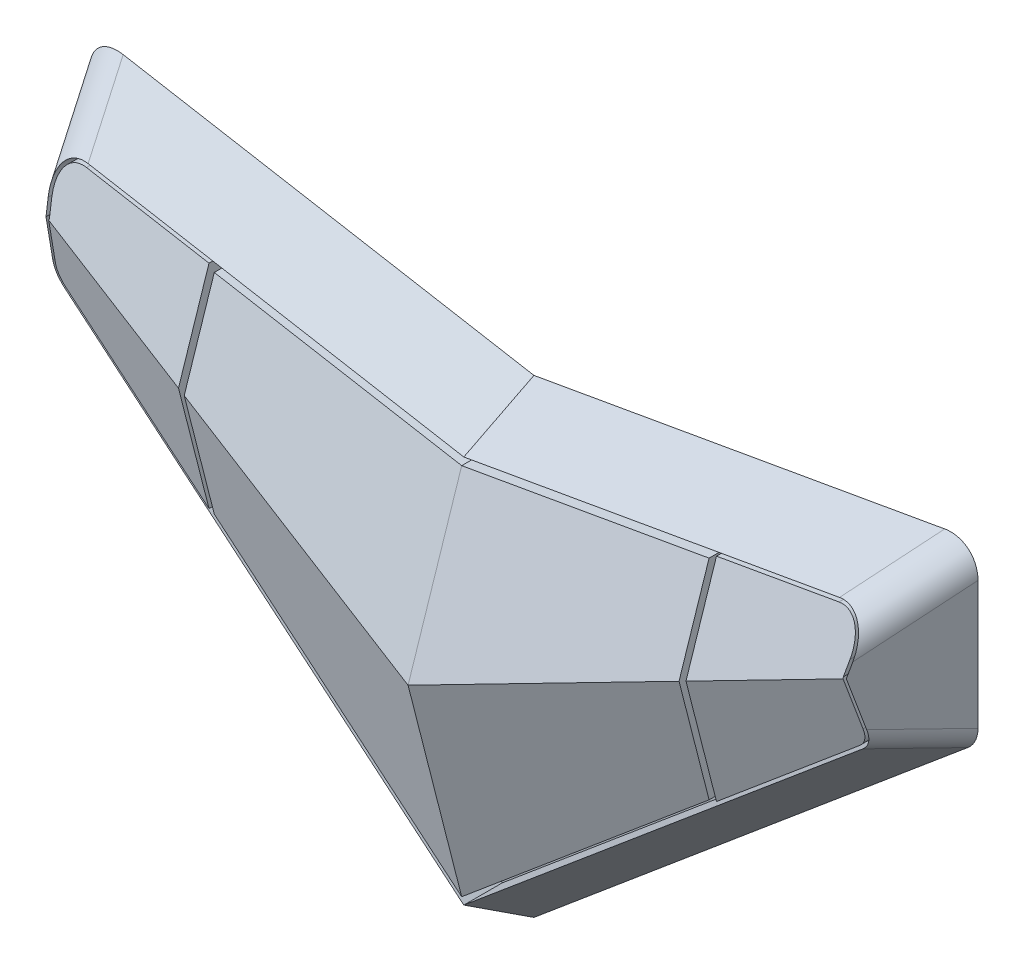
from build123d import *

# Parameters (mm, degrees)
CHAMFER_1_SIZE      = 10
CHAMFER_1_SIZE_2    = 22.360679775
FILLET_3_R          = 5
CUT_EXTRUDE_START   = 5
CUT_EXTRUDE_2_DEPTH = 108.268120159
CUT_EXTRUDE_3_DEPTH = 108.268120141


with BuildPart() as part:
    # 草图1 → 放样1 section 0
    with BuildSketch(Plane.XY):
        with BuildLine():
            Line((0, 74), (70, 86.34288865))
            Line((70, 86.34288865), (70, 58.736974182))
            Line((70, 58.736974182), (0, 0))
            Line((0, 0), (-70, 58.736974182))
            Line((-70, 58.736974182), (-70, 86.34288865))
            Line((-70, 86.34288865), (0, 74))
        make_face()
    # 草图2 → 放样1 section 1
    with BuildSketch(Plane.XY.offset(20)):
        with BuildLine():
            Line((60, 74.425352724), (0, 63.845733881))
            Line((0, 63.845733881), (-60, 74.425352724))
            Line((-60, 74.425352724), (-60, 63.400050764))
            Line((-60, 63.400050764), (0, 13.054072893))
            Line((0, 13.054072893), (60, 63.400050764))
            Line((60, 63.400050764), (60, 74.425352724))
        make_face()
    loft()

    # 倒角1
    # the kernel refuses this chamfer: 22.360679775, 10 mm, written as the material it takes off along each edge
    with BuildSketch(Plane(origin=(57.145762753, 53.769394075, 20), x_dir=(0.07765782588644504, 0.44041941610082364, -0.8944271909999159), z_dir=(-0.9848077530122075, 0.17364817766693405, 0))) as chamfer_1_piece_1_section:
        Polygon((CHAMFER_1_SIZE, 0), (-CHAMFER_1_SIZE_2 * 0.4472135955, CHAMFER_1_SIZE_2 * 0.894427191), (0, 0), align=None)
    chamfer_1_piece_1 = extrude(amount=176.980253225, mode=Mode.PRIVATE)
    chamfer_1_piece_1 = split(chamfer_1_piece_1, bisect_by=Plane(origin=(57.189420764, 53.521797191, 19.245750606), z_dir=(-0.05491237529650921, 0.3114235556911101, 0.9486832980505147)), keep=Keep.TOP, mode=Mode.PRIVATE)
    add(chamfer_1_piece_1, mode=Mode.SUBTRACT)
    with BuildSketch(Plane(origin=(117.145762753, 84.50169253, 20), x_dir=(-0.0776578258864451, 0.4404194161008233, -0.8944271909999161), z_dir=(-0.9848077530122074, -0.1736481776669343, 0))) as chamfer_1_piece_2_section:
        Polygon((CHAMFER_1_SIZE, 0), (-CHAMFER_1_SIZE_2 * 0.4472135955, CHAMFER_1_SIZE_2 * 0.894427191), (0, 0), align=None)
    chamfer_1_piece_2 = extrude(amount=176.980253225, mode=Mode.PRIVATE)
    chamfer_1_piece_2 = split(chamfer_1_piece_2, bisect_by=Plane(origin=(116.05099823, 78.292974393, 1.086507133), z_dir=(0.054912375296509185, 0.31142355569111035, 0.9486832980505147)), keep=Keep.TOP, mode=Mode.PRIVATE)
    add(chamfer_1_piece_2, mode=Mode.SUBTRACT)
    with BuildSketch(Plane(origin=(-44.451512359, -24.245174733, 20), x_dir=(0.28746335807073986, -0.34258548972000163, -0.894427190999916), z_dir=(0.7660444431189795, 0.6427876096865376, 0)), Plane(origin=(-104.451512359, 100.69929839, 20), x_dir=(-0.28746335807074064, -0.3425854897200026, -0.8944271909999154), z_dir=(0.7660444431189795, -0.6427876096865376, 0))) as chamfer_1_piece_3:
        Polygon((CHAMFER_1_SIZE, 0), (-CHAMFER_1_SIZE_2 * 0.4472135955, CHAMFER_1_SIZE_2 * 0.894427191), (0, 0), align=None)
    extrude(amount=194.379093872, mode=Mode.SUBTRACT)

    # 圆角3
    fillet_3_edges = [part.edges().sort_by_distance(p)[0] for p in [
        (-67.236067978, 60.025816851, 5.527864045),
        (-67.236067978, 83.048962732, 5.527864045),
        (67.236067977, 60.025816851, 5.527864045),
        (67.236067977, 83.048962732, 5.527864045),
    ]]
    fillet(fillet_3_edges, radius=FILLET_3_R)

    # 草图7 → 切除-拉伸2 (cut, through all)
    with BuildSketch(Plane.XY.offset(CUT_EXTRUDE_START)):
        Polygon((-40, 75.43993897), (-40, 40.780099266), (0, 7.216114019), (40, 40.780099266), (40, 75.43993897), (0, 68.386859742), align=None)
        Polygon((-39, 74.248185378), (0, 67.37143313), (39, 74.248185378), (39, 41.246406924), (0, 8.521521308), (-39, 41.246406924), align=None, mode=Mode.SUBTRACT)
    extrude(amount=CUT_EXTRUDE_2_DEPTH, mode=Mode.SUBTRACT)

    # 草图9 → 切除-拉伸3 (cut, through all)
    with BuildSketch(Plane.XY.offset(CUT_EXTRUDE_START)):
        with BuildLine():
            Line((-40, 75.43993897), (0, 68.386859742))
            Line((0, 68.386859742), (40, 75.43993897))
            Line((40, 75.43993897), (59.223421741, 78.829546885))
            add(Edge.make_bspline(
                [(63.422393112, 73.174317919), (64.472135955, 79.755036815), (59.223421741, 78.829546885)],
                knots=[2.124820971, 2.124820971, 2.124820971, 3.634497794, 3.634497794, 3.634497794], degree=2, weights=[1, 0.728382268, 1]))
            Line((63.422393112, 73.174317919), (63.081692851, 71.038506602))
            Line((63.081692851, 71.038506602), (64.15263548, 63.549036282))
            add(Edge.make_bspline(
                [(62.874633581, 59.974195867), (64.472135955, 61.31465952), (64.15263548, 63.549036282)],
                knots=[2.89691376, 2.89691376, 2.89691376, 3.672186613, 3.672186613, 3.672186613], degree=2, weights=[1, 0.925805079, 1]))
            Line((62.874633581, 59.974195867), (40, 40.780099266))
            Line((40, 40.780099266), (0, 7.216114019))
            Line((0, 7.216114019), (-40, 40.780099266))
            Line((-40, 40.780099266), (-62.874633581, 59.974195867))
            add(Edge.make_bspline(
                [(-64.15263548, 63.549036282), (-64.472135955, 61.31465952), (-62.874633581, 59.974195867)],
                knots=[2.610998694, 2.610998694, 2.610998694, 3.386271547, 3.386271547, 3.386271547], degree=2, weights=[1, 0.925805079, 1]))
            Line((-64.15263548, 63.549036282), (-63.081692851, 71.038506602))
            Line((-63.081692851, 71.038506602), (-63.422393112, 73.174317919))
            add(Edge.make_bspline(
                [(-59.223421741, 78.829546885), (-64.472135955, 79.755036815), (-63.422393112, 73.174317919)],
                knots=[2.648687513, 2.648687513, 2.648687513, 4.158364336, 4.158364336, 4.158364336], degree=2, weights=[1, 0.728382268, 1]))
            Line((-59.223421741, 78.829546885), (-40, 75.43993897))
        make_face()
        with BuildLine():
            Line((-59.31024583, 78.337143008), (-40.086824089, 74.947535094))
            Line((-40.086824089, 74.947535094), (0, 67.879146436))
            Line((0, 67.879146436), (40.086824089, 74.947535094))
            Line((40.086824089, 74.947535094), (59.31024583, 78.337143008))
            add(Edge.make_bspline(
                [(59.31024583, 78.337143008), (59.606035397, 78.389298689), (60.236089665, 78.427658938), (61.023214098, 78.258065344), (61.707637648, 77.888235871), (62.45863279, 77.130661919), (62.942544445, 75.958588793), (63.064569227, 74.489707699), (62.992457265, 73.653171126), (62.92863572, 73.253081091)],
                knots=[2.124820971, 2.124820971, 2.124820971, 2.124820971, 2.313530574, 2.502240177, 2.69094978, 2.879659382, 3.257078588, 3.445788191, 3.634497794, 3.634497794, 3.634497794, 3.634497794], degree=3))
            Line((62.92863572, 73.253081091), (62.576022888, 71.04259122))
            Line((62.576022888, 71.04259122), (63.657670159, 63.478259653))
            add(Edge.make_bspline(
                [(63.657670159, 63.478259653), (63.701203567, 63.173815556), (63.721909403, 62.536225056), (63.535721886, 61.698867433), (63.156823887, 60.958692701), (62.768132959, 60.537534879), (62.553239776, 60.357218088)],
                knots=[2.89691376, 2.89691376, 2.89691376, 2.89691376, 3.090731973, 3.284550187, 3.4783684, 3.672186613, 3.672186613, 3.672186613, 3.672186613], degree=3))
            Line((62.553239776, 60.357218088), (39.678606195, 41.163121487))
            Line((39.678606195, 41.163121487), (0, 7.868817663))
            Line((0, 7.868817663), (-39.678606195, 41.163121487))
            Line((-39.678606195, 41.163121487), (-62.553239776, 60.357218088))
            add(Edge.make_bspline(
                [(-62.553239776, 60.357218088), (-62.768132959, 60.537534879), (-63.156823887, 60.958692701), (-63.535721886, 61.698867433), (-63.721909403, 62.536225056), (-63.701203567, 63.173815556), (-63.657670159, 63.478259653)],
                knots=[2.610998694, 2.610998694, 2.610998694, 2.610998694, 2.804816907, 2.998635121, 3.192453334, 3.386271547, 3.386271547, 3.386271547, 3.386271547], degree=3))
            Line((-63.657670159, 63.478259653), (-62.576022888, 71.04259122))
            Line((-62.576022888, 71.04259122), (-62.92863572, 73.253081091))
            add(Edge.make_bspline(
                [(-62.92863572, 73.253081091), (-62.992457265, 73.653171126), (-63.064569227, 74.489707699), (-62.942544445, 75.958588793), (-62.45863279, 77.130661919), (-61.707637648, 77.888235871), (-61.023214098, 78.258065344), (-60.236089665, 78.427658938), (-59.606035397, 78.389298689), (-59.31024583, 78.337143008)],
                knots=[2.648687513, 2.648687513, 2.648687513, 2.648687513, 2.837397116, 3.026106719, 3.403525925, 3.592235528, 3.78094513, 3.969654733, 4.158364336, 4.158364336, 4.158364336, 4.158364336], degree=3))
        make_face(mode=Mode.SUBTRACT)
    extrude(amount=CUT_EXTRUDE_3_DEPTH, mode=Mode.SUBTRACT)


solid = part.part
